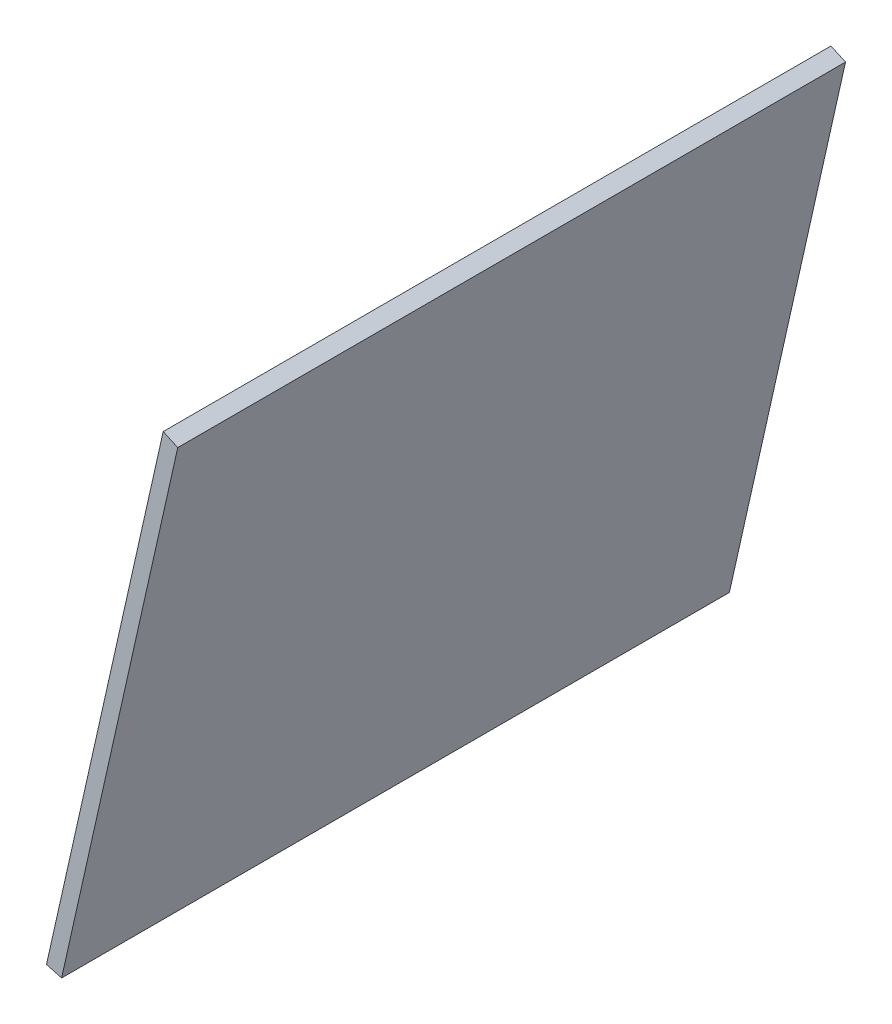
from build123d import *

# Parameters (mm, degrees)
BOSS_EXTRUDE1_DEPTH = 812.8


with BuildPart() as part:
    # Sketch1 → Boss-Extrude1 (new body)
    with BuildSketch(Plane.XY):
        Polygon((-596.865528173, 1608.234044775), (-738.251729964, 978.422782255), (-756.661390935, 983.387185214), (-614.581858176, 1616.286922049), align=None)
    extrude(amount=BOSS_EXTRUDE1_DEPTH)


solid = part.part
